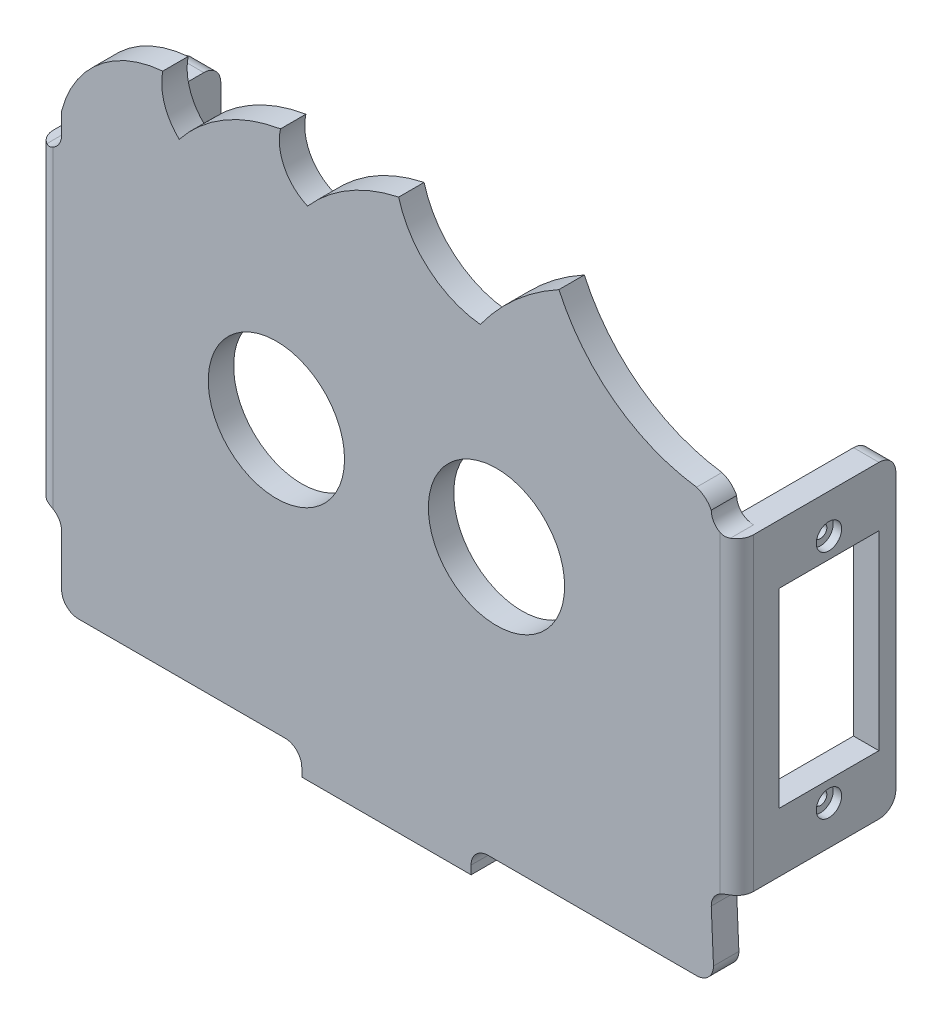
from build123d import *

# Parameters (mm, degrees)
MODEL_R                 = 8.05
SALIENTE_EXTRUIR1_DEPTH = 3
CROQUIS2_W              = 3
CROQUIS2_H              = 36.500000005
SALIENTE_EXTRUIR2_DEPTH = 18.8
REDONDEO1_R             = 2
CROQUIS3_R              = 0.75
CROQUIS3_W              = 11.8
CROQUIS3_H              = 22.5
CORTAR_EXTRUIR1_DEPTH   = 15.8
CROQUIS7_R              = 1.5
CORTAR_EXTRUIR3_DEPTH   = 1
SIMETR_A1_START         = 177.868163256
SIMETR_A1_OUTLINE_R     = 1.5
SIMETR_A1_OUTLINE_W     = 22.5
SIMETR_A1_OUTLINE_H     = 11.8
SIMETR_A1_DEPTH         = 3
SIMETR_A1_2_OUTLINE_R   = 1.5
SIMETR_A1_2_OUTLINE_R_2 = 0.75
SIMETR_A1_2_DEPTH       = 2
CROQUIS5_W              = 20
CROQUIS5_H              = 3
SALIENTE_EXTRUIR3_DEPTH = 11
REDONDEO2_R             = 2
CROQUIS6_R              = 1.289460228
CORTAR_EXTRUIR2_DEPTH   = 3
CROQUIS8_R              = 2.25
CORTAR_EXTRUIR4_DEPTH   = 1
REDONDEO3_R             = 2


# Read off the part's stored shape, not the designer's step: Simetría1
with BuildPart() as part:
    # Model → Saliente-Extruir1 (new body)
    with BuildSketch(Plane.XY):
        with BuildLine():
            Line((129.495355099, -134.938548449), (149.495355099, -134.938548449))
            Line((149.495355099, -134.938548449), (149.495355099, -133.938548449))
            ThreePointArc((149.495355099, -133.938548449), (150.081141537, -132.524334887), (151.495355099, -131.938548449))
            Line((151.495355099, -131.938548449), (176.128197203, -131.938548449))
            ThreePointArc((176.128197203, -131.938548449), (177.538284884, -131.35687589), (178.128163256, -129.950201179))
            Line((178.128163256, -129.950201179), (177.862546943, -123.950201137))
            ThreePointArc((177.862546943, -123.950201137), (178.44833338, -122.535987575), (179.862546943, -121.950201137))
            Line((179.862546943, -121.950201137), (180.862546943, -121.950201137))
            Line((180.862546943, -121.950201137), (180.862546943, -85.450201132))
            Line((180.862546943, -85.450201132), (179.862546943, -85.450201132))
            ThreePointArc((179.862546943, -85.450201132), (178.44833338, -84.864414695), (177.862546943, -83.450201132))
            ThreePointArc((177.862546943, -83.450201132), (177.142837957, -82.533630305), (176.128163256, -81.960465095))
            ThreePointArc((176.128163256, -81.960465095), (166.435178179, -78.024818287), (159.872429316, -69.877818664))
            ThreePointArc((159.872429316, -69.877818664), (154.765410937, -73.462979643), (150.58174723, -78.092447642))
            ThreePointArc((150.58174723, -78.092447642), (144.486823712, -75.481596568), (140.942488903, -69.877818664))
            ThreePointArc((140.942488903, -69.877818664), (135.047590207, -72.161784577), (130.172970832, -76.18725559))
            ThreePointArc((130.172970832, -76.18725559), (127.440920733, -73.607562885), (126.984938003, -69.877818664))
            ThreePointArc((126.984938003, -69.877818664), (120.346137898, -72.294388425), (115.017340976, -76.933073543))
            ThreePointArc((115.017340976, -76.933073543), (113.269189628, -74.182373632), (113.071027177, -70.929203673))
            ThreePointArc((113.071027177, -70.929203673), (105.5068889, -74.040793408), (101.128163256, -80.949117392))
            Line((101.128163256, -80.949117392), (101.128163256, -83.450201132))
            ThreePointArc((101.128163256, -83.450201132), (100.542376818, -84.864414695), (99.128163256, -85.450201132))
            Line((99.128163256, -85.450201132), (98.128163256, -85.450201132))
            Line((98.128163256, -85.450201132), (98.128163256, -121.950201137))
            Line((98.128163256, -121.950201137), (99.128163256, -121.950201137))
            ThreePointArc((99.128163256, -121.950201137), (100.542376818, -122.535987575), (101.128163256, -123.950201137))
            Line((101.128163256, -123.950201137), (101.128163256, -129.950201137))
            ThreePointArc((101.128163256, -129.950201137), (101.714262231, -131.364727168), (103.129047148, -131.950200942))
            Line((103.129047148, -131.950200942), (127.494471207, -131.939432732))
            ThreePointArc((127.494471207, -131.939432732), (128.909256124, -132.524906506), (129.495355099, -133.939432537))
            Line((129.495355099, -133.939432537), (129.495355099, -134.938548449))
        make_face()
        with Locations((126.495355099, -99.894288355)):
            Circle(MODEL_R, mode=Mode.SUBTRACT)
        with Locations((152.495355099, -99.894288355)):
            Circle(MODEL_R, mode=Mode.SUBTRACT)
    extrude(amount=SALIENTE_EXTRUIR1_DEPTH)

    # Croquis2 → Saliente-Extruir2 (add)
    with BuildSketch(Plane.XY.offset(3)):
        with Locations((99.628163256, -103.700201135)):
            Rectangle(CROQUIS2_W, CROQUIS2_H)
    extrude(amount=-SALIENTE_EXTRUIR2_DEPTH)

    # Redondeo1
    redondeo1_edges = [part.edges().sort_by_distance(p)[0] for p in [
        (99.628163256, -121.950201137, -15.8),
        (99.628163256, -85.450201132, -15.8),
        (98.128163256, -103.700201135, 3),
    ]]
    fillet(redondeo1_edges, radius=REDONDEO1_R)

    # Croquis3 → Cortar-Extruir1 (cut)
    with BuildSketch(Plane.ZY.offset(-98.128163256)):
        with Locations((-7.9, -117.350201137)):
            Circle(CROQUIS3_R)
        with Locations((-7.9, -90.050201137)):
            Circle(CROQUIS3_R)
        with Locations((-7.9, -103.700201137)):
            Rectangle(CROQUIS3_W, CROQUIS3_H)
    extrude(amount=-CORTAR_EXTRUIR1_DEPTH, mode=Mode.SUBTRACT)

    # Croquis7 → Cortar-Extruir3 (cut)
    with BuildSketch(Plane.ZY.offset(-98.128163256)):
        with Locations((-7.9, -90.050201137)):
            Circle(CROQUIS7_R)
        with Locations((-7.9, -117.350201137)):
            Circle(CROQUIS7_R)
    extrude(amount=-CORTAR_EXTRUIR3_DEPTH, mode=Mode.SUBTRACT)

    # Simetría1 outline → Simetría1 (add)
    with BuildSketch(Plane.YZ.offset(SIMETR_A1_START)):
        with BuildLine():
            ThreePointArc((-121.950201137, -13.8), (-121.364414699, -15.214213562), (-119.950201137, -15.8))
            Line((-119.950201137, -15.8), (-87.450201132, -15.8))
            ThreePointArc((-87.450201132, -15.8), (-86.03598757, -15.214213562), (-85.450201132, -13.8))
            Line((-85.450201132, -13.8), (-85.450201132, 3))
            Line((-85.450201132, 3), (-121.950201137, 3))
            Line((-121.950201137, 3), (-121.950201137, -13.8))
        make_face()
        with Locations((-117.350201137, -7.9)):
            Circle(SIMETR_A1_OUTLINE_R, mode=Mode.SUBTRACT)
        with Locations((-103.700201137, -7.9)):
            Rectangle(SIMETR_A1_OUTLINE_W, SIMETR_A1_OUTLINE_H, mode=Mode.SUBTRACT)
        with Locations((-90.050201137, -7.9)):
            Circle(SIMETR_A1_OUTLINE_R, mode=Mode.SUBTRACT)
    extrude(amount=SIMETR_A1_DEPTH)

    # Simetr_a1 2 outline → Simetr_a1 2 (add)
    # profile 1 of 2: a face of its own
    with BuildSketch(Plane.YZ.offset(SIMETR_A1_START)):
        with Locations((-117.350201137, -7.9)):
            Circle(SIMETR_A1_2_OUTLINE_R)
        with Locations((-117.350201137, -7.9)):
            Circle(SIMETR_A1_2_OUTLINE_R_2, mode=Mode.SUBTRACT)
    # profile 2 of 2: a face of its own
    with BuildSketch(Plane.YZ.offset(SIMETR_A1_START)):
        with Locations((-90.050201137, -7.9)):
            Circle(SIMETR_A1_2_OUTLINE_R)
        with Locations((-90.050201137, -7.9)):
            Circle(SIMETR_A1_2_OUTLINE_R_2, mode=Mode.SUBTRACT)
    extrude(amount=SIMETR_A1_2_DEPTH)

    # Croquis5 → Saliente-Extruir3 (add)
    with BuildSketch(Plane.XY.offset(3)):
        with Locations((139.495355099, -133.438548449)):
            Rectangle(CROQUIS5_W, CROQUIS5_H)
    extrude(amount=-SALIENTE_EXTRUIR3_DEPTH)

    # Redondeo2
    redondeo2_edges = [part.edges().sort_by_distance(p)[0] for p in [
        (129.495355099, -133.438548449, -8),
        (149.495355099, -133.438548449, -8),
    ]]
    fillet(redondeo2_edges, radius=REDONDEO2_R)

    # Croquis6 → Cortar-Extruir2 (cut)
    with BuildSketch(Plane(origin=(0, -131.938548449, 0), x_dir=(1, 0, 0), z_dir=(0, 1, 0))):
        with Locations(Location((133.495355099, 3.5, 0), (0, 0, 270))):
            Circle(CROQUIS6_R)
        with Locations(Location((145.495355099, 3.5, 0), (0, 0, 90))):
            Circle(CROQUIS6_R)
    extrude(amount=-CORTAR_EXTRUIR2_DEPTH, mode=Mode.SUBTRACT)

    # Croquis8 → Cortar-Extruir4 (cut)
    with BuildSketch(Plane(origin=(0, -131.938548449, 0), x_dir=(1, 0, 0), z_dir=(0, 1, 0))):
        with Locations(Location((145.495355099, 3.5, 0), (0, 0, 270))):
            Circle(CROQUIS8_R)
        with Locations(Location((133.495355099, 3.5, 0), (0, 0, 270))):
            Circle(CROQUIS8_R)
    extrude(amount=-CORTAR_EXTRUIR4_DEPTH, mode=Mode.SUBTRACT)

    # Redondeo3
    # the kernel refuses this fillet: 2 mm, written as the material it takes off along each edge
    with BuildSketch(Plane(origin=(180.868163256, -80.450201132, 3), x_dir=(-1, 0, 0), z_dir=(0, -1, 0))) as redondeo3_piece_1:
        with BuildLine():
            CenterArc((REDONDEO3_R, REDONDEO3_R), REDONDEO3_R, 180, 90)
            Line((0, REDONDEO3_R), (0, 0))
            Line((0, 0), (REDONDEO3_R, 0))
        make_face()
    extrude(amount=46.500000005, mode=Mode.SUBTRACT)


solid = part.part
